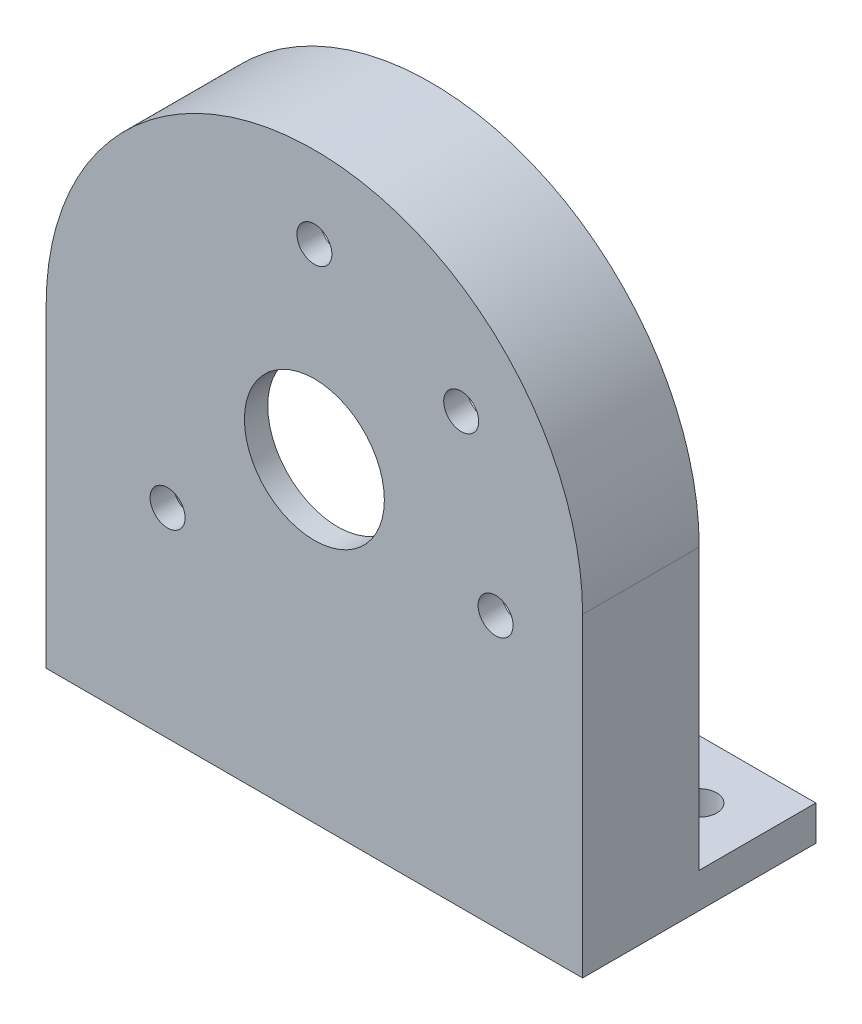
from build123d import *

# Parameters (mm, degrees)
EXTRUDE_1_DEPTH     = 20
CUT_EXTRUDE_1_DEPTH = 10
SKETCH_3_R          = 21
CUT_EXTRUDE_2_DEPTH = 8
SKETCH_6_R          = 1.5
CUT_EXTRUDE_3_DEPTH = 5
SKETCH_7_R          = 1.5
CUT_EXTRUDE_6_DEPTH = 3
SKETCH_8_R          = 6
CUT_EXTRUDE_7_DEPTH = 3


with BuildPart() as part:
    # 草图1 → 凸台-拉伸1 (new body)
    with BuildSketch(Plane.XY):
        with BuildLine():
            Line((-23, 0), (-23, -27))
            Line((-23, -27), (23, -27))
            Line((23, -27), (23, 0))
            ThreePointArc((23, 0), (0, 23), (-23, 0))
        make_face()
    extrude(amount=EXTRUDE_1_DEPTH)

    # 草图2 → 切除-拉伸1 (cut)
    with BuildSketch(Plane(origin=(0, 0, 0), x_dir=(-1, 0, 0), z_dir=(0, 0, -1))):
        with BuildLine():
            Line((-23, -24), (23, -24))
            Line((23, -24), (23, 0))
            ThreePointArc((23, 0), (0, 23), (-23, 0))
            Line((-23, 0), (-23, -24))
        make_face()
    extrude(amount=-CUT_EXTRUDE_1_DEPTH, mode=Mode.SUBTRACT)

    # 草图3 → 切除-拉伸2 (cut)
    with BuildSketch(Plane(origin=(0, 0, 10), x_dir=(-1, 0, 0), z_dir=(0, 0, -1))):
        Circle(SKETCH_3_R)
    extrude(amount=-CUT_EXTRUDE_2_DEPTH, mode=Mode.SUBTRACT)

    # 草图6 → 切除-拉伸3 (cut)
    with BuildSketch(Plane.XZ.offset(27)):
        with Locations((-18, 15)):
            Circle(SKETCH_6_R)
        with Locations((18, 15)):
            Circle(SKETCH_6_R)
        with Locations((18, 5)):
            Circle(SKETCH_6_R)
        with Locations((-18, 5)):
            Circle(SKETCH_6_R)
    extrude(amount=-CUT_EXTRUDE_3_DEPTH, mode=Mode.SUBTRACT)

    # 草图7 → 切除-拉伸6 (cut)
    with BuildSketch(Plane.XY.offset(20)):
        with Locations((0, 16)):
            Circle(SKETCH_7_R)
        with Locations((12.589057749, 9.875)):
            Circle(SKETCH_7_R)
        with Locations((-12.589057749, -9.875)):
            Circle(SKETCH_7_R)
        with Locations((15.539618159, -3.810546875)):
            Circle(SKETCH_7_R)
    extrude(amount=-CUT_EXTRUDE_6_DEPTH, mode=Mode.SUBTRACT)

    # 草图8 → 切除-拉伸7 (cut)
    with BuildSketch(Plane(origin=(0, 0, 18), x_dir=(-1, 0, 0), z_dir=(0, 0, -1))):
        Circle(SKETCH_8_R)
    extrude(amount=-CUT_EXTRUDE_7_DEPTH, mode=Mode.SUBTRACT)


solid = part.part
